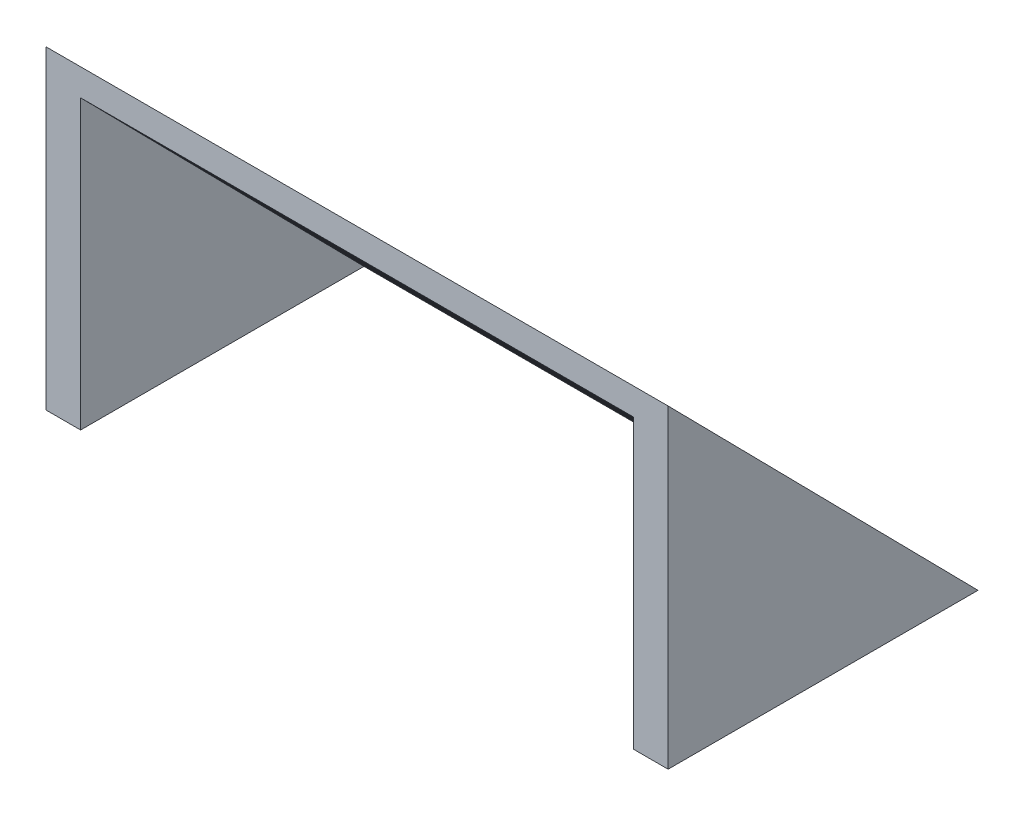
from build123d import *

# Parameters (mm, degrees)
P_IDAT_VYSUNUT_M1_DEPTH  = 2.2
SKICA2_W                 = 35.15
SKICA2_H                 = 28.072940708
P_IDAT_VYSUNUT_M2_DEPTH  = 1.2
LINPOLE1_COUNT           = 2
LINPOLE1_PITCH           = 37.35
SKICA3_W                 = 2.46853356
SKICA3_H                 = 4.337658353
SKICA3_W_2               = 5.363858138
SKICA3_H_2               = 3.395185275
ODEBRAT_VYSUNUT_M1_DEPTH = 49.500438142


with BuildPart() as part:
    # Skica1 → Přidat vysunutím1 (new body)
    with BuildSketch(Plane(origin=(0, 0, 0), x_dir=(0, 0, -1), z_dir=(1, 0, 0))):
        Polygon((0, 0), (0, 20), (19.7, 0), align=None)
    p_idat_vysunut_m1 = extrude(amount=P_IDAT_VYSUNUT_M1_DEPTH)

    # Skica2 → Přidat vysunutím2 (add)
    with BuildSketch(Plane(origin=(0, 9.848875128, -9.998857998), x_dir=(-1, 0, 0), z_dir=(0, 0.7017433693479112, -0.7124298165968641))):
        with Locations((-19.775, 0.212125978)):
            Rectangle(SKICA2_W, SKICA2_H)
    extrude(amount=-P_IDAT_VYSUNUT_M2_DEPTH)

    # LinPole1: Přidat vysunutím1 ×2
    with Locations(*[(i * LINPOLE1_PITCH, 0, 0) for i in range(1, LINPOLE1_COUNT)]):
        add(p_idat_vysunut_m1)

    # Skica3 → Odebrat vysunutím1 (cut, through all)
    with BuildSketch(Plane(origin=(39.55, 0, 0), x_dir=(0, 0, -1), z_dir=(1, 0, 0))):
        with Locations((-1.23426678, 19.003869159)):
            Rectangle(SKICA3_W, SKICA3_H)
        with Locations((19.532023183, -1.697592638)):
            Rectangle(SKICA3_W_2, SKICA3_H_2)
    extrude(amount=-ODEBRAT_VYSUNUT_M1_DEPTH, mode=Mode.SUBTRACT)


solid = part.part
